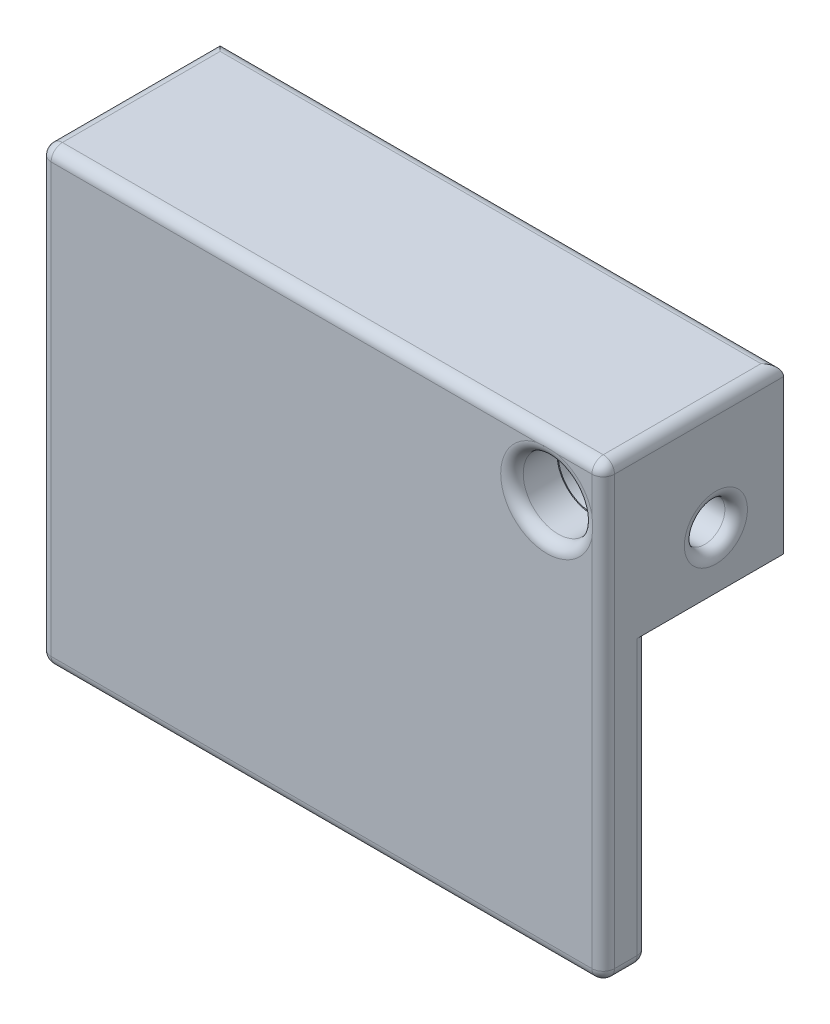
from build123d import *

# Parameters (mm, degrees)
ESQUISSE1_W             = 25
ESQUISSE1_H             = 20
ESQUISSE1_R             = 1.55
BOSS_EXTRU_1_DEPTH      = 2
ESQUISSE2_R             = 1.5
BOSS_EXTRU_2_DEPTH      = 6
ESQUISSE3_R             = 2
ENL_V_MAT_EXTRU_1_DEPTH = 1
ESQUISSE4_R             = 0.9
ENL_V_MAT_EXTRU_2_DEPTH = 33.57299495
CONG_1_R                = 0.5
CONG_5_R                = 0.5
CONG_6_R                = 0.5


with BuildPart() as part:
    # Esquisse1 → Boss.-Extru.1 (new body)
    with BuildSketch(Plane.XY):
        with Locations((12.5, 10)):
            Rectangle(ESQUISSE1_W, ESQUISSE1_H)
        with Locations((22.5, 17.5)):
            Circle(ESQUISSE1_R, mode=Mode.SUBTRACT)
    extrude(amount=BOSS_EXTRU_1_DEPTH)

    # Esquisse2 → Boss.-Extru.2 (add)
    with BuildSketch(Plane(origin=(0, 0, 0), x_dir=(-1, 0, 0), z_dir=(0, 0, -1))):
        Polygon((-18.688890735, 12.684019913), (-18.688890735, 15.355693182), (-18.19165929, 15.852924628), (-6.705637613, 15.852924628), (-4.442134245, 13.58942126), (-4.442134245, 13.288407081), (-1.8, 13.288407081), (-1.8, 2), (0, 2), (0, 13.565515823), (0, 20), (-25, 20), (-25, 12.684019913), align=None)
        with Locations((-22.5, 17.5)):
            Circle(ESQUISSE2_R, mode=Mode.SUBTRACT)
    extrude(amount=BOSS_EXTRU_2_DEPTH)

    # Esquisse3 → Enlèv. mat.-Extru.1 (cut)
    with BuildSketch(Plane(origin=(1.8, 0, 0), x_dir=(0, 0, -1), z_dir=(1, 0, 0))):
        with Locations(Location((3, 8, 0), (0, 0, 90))):
            Circle(ESQUISSE3_R)
    extrude(amount=-ENL_V_MAT_EXTRU_1_DEPTH, mode=Mode.SUBTRACT)

    # Esquisse4 → Enlèv. mat.-Extru.2 (cut, through all)
    with BuildSketch(Plane.ZY):
        with Locations((-3, 15.2)):
            Circle(ESQUISSE4_R)
    extrude(amount=-ENL_V_MAT_EXTRU_2_DEPTH, mode=Mode.SUBTRACT)

    # Congé1
    # the kernel refuses this fillet: 0.5 mm, written as the material it takes off along each edge
    with BuildSketch(Plane(origin=(25, 15.2, -3), x_dir=(0, 0, 1), z_dir=(0, -1, 0))) as cong_1_piece_1:
        with BuildLine():
            CenterArc((0.9 + CONG_1_R, CONG_1_R), CONG_1_R, 180, 90)
            Line((0.9, CONG_1_R), (0.9, 0))
            Line((0.9, 0), (0.9 + CONG_1_R, 0))
        make_face()
    revolve(axis=Axis((25, 15.2, -3), (-1, 0, 0)), mode=Mode.SUBTRACT)
    with BuildSketch(Plane(origin=(18.688890735, 15.2, -3), x_dir=(0, 0.9999845857082649, -0.005552327968503009), z_dir=(0, 0.005552327968503009, 0.9999845857082649))) as cong_1_piece_2_section:
        with BuildLine():
            CenterArc((0.9 + CONG_1_R, -CONG_1_R), CONG_1_R, 90, 90)
            Line((0.9 + CONG_1_R, 0), (0.9, 0))
            Line((0.9, 0), (0.9, -CONG_1_R))
        make_face()
    cong_1_piece_2 = revolve(axis=Axis((18.688890735, 15.2, -3), (-1, 0, 0)), revolution_arc=269.681873406, mode=Mode.PRIVATE)
    cong_1_piece_2 = split(cong_1_piece_2, bisect_by=Plane(origin=(19.358402527, 14.68618139, -3.05957258), z_dir=(-0.7071067811865438, -0.7071067811865513, 0)), keep=Keep.TOP, mode=Mode.PRIVATE)
    add(cong_1_piece_2, mode=Mode.SUBTRACT)
    with BuildSketch(Plane(origin=(0, 15.2, -3), x_dir=(0, 0, 1), z_dir=(0, -1, 0))) as cong_1_piece_3:
        with BuildLine():
            CenterArc((0.9 + CONG_1_R, -CONG_1_R), CONG_1_R, 90, 90)
            Line((0.9, -CONG_1_R), (0.9, 0))
            Line((0.9, 0), (0.9 + CONG_1_R, 0))
        make_face()
    revolve(axis=Axis((0, 15.2, -3), (-1, 0, 0)), mode=Mode.SUBTRACT)
    with BuildSketch(Plane(origin=(18.688890735, 15.2, -3), x_dir=(0, 0, 1), z_dir=(0, -1, 0))) as cong_1_piece_4_section:
        with BuildLine():
            CenterArc((0.9 + CONG_1_R, -CONG_1_R), CONG_1_R, 90, 90)
            Line((0.9 + CONG_1_R, 0), (0.9, 0))
            Line((0.9, 0), (0.9, -CONG_1_R))
        make_face()
    cong_1_piece_4 = revolve(axis=Axis((18.688890735, 15.2, -3), (-1, 0, 0)), revolution_arc=89.539713829, mode=Mode.PRIVATE)
    cong_1_piece_4 = split(cong_1_piece_4, bisect_by=Plane(origin=(18.759427014, 15.285156904, -1.94281096), z_dir=(-0.7071067811865438, -0.7071067811865513, 0)), keep=Keep.TOP, mode=Mode.PRIVATE)
    add(cong_1_piece_4, mode=Mode.SUBTRACT)

    # Congé5
    # the kernel refuses this fillet: 0.5 mm, written as the material it takes off along each edge
    with BuildSketch(Plane(origin=(24.5, 0.5, 1.5), x_dir=(0, 0, 1), z_dir=(0, -1, 0))) as cong_5_piece_1_section:
        Polygon((0, 0), (CONG_5_R, 0), (CONG_5_R, -CONG_5_R), (0, -CONG_5_R), align=None)
    cong_5_piece_1 = extrude(amount=CONG_5_R, mode=Mode.PRIVATE)
    cong_5_piece_1 = cong_5_piece_1 - Plane(origin=(24.5, 0.5, 1.5), x_dir=(-0.7071067811865475, 0, -0.7071067811865475), z_dir=(0, -1, 0)) * Sphere(CONG_5_R, mode=Mode.PRIVATE)
    add(cong_5_piece_1, mode=Mode.SUBTRACT)
    with BuildSketch(Plane(origin=(24.5, 19.5, 1.5), x_dir=(1, 0, 0), z_dir=(0, 0, 1))) as cong_5_piece_2_section:
        Polygon((0, 0), (CONG_5_R, 0), (CONG_5_R, CONG_5_R), (0, CONG_5_R), align=None)
    cong_5_piece_2 = extrude(amount=CONG_5_R, mode=Mode.PRIVATE)
    cong_5_piece_2 = cong_5_piece_2 - Plane(origin=(24.5, 19.5, 1.5), x_dir=(-0.7071067811865475, -0.7071067811865475, 0), z_dir=(0, 0, 1)) * Sphere(CONG_5_R, mode=Mode.PRIVATE)
    add(cong_5_piece_2, mode=Mode.SUBTRACT)
    with BuildSketch(Plane(origin=(0.5, 19.5, 1.5), x_dir=(-1, 0, 0), z_dir=(0, 0, 1))) as cong_5_piece_3_section:
        Polygon((0, 0), (CONG_5_R, 0), (CONG_5_R, -CONG_5_R), (0, -CONG_5_R), align=None)
    cong_5_piece_3 = extrude(amount=CONG_5_R, mode=Mode.PRIVATE)
    cong_5_piece_3 = cong_5_piece_3 - Plane(origin=(0.5, 19.5, 1.5), x_dir=(0.7071067811865475, -0.7071067811865475, 0), z_dir=(0, 0, 1)) * Sphere(CONG_5_R, mode=Mode.PRIVATE)
    add(cong_5_piece_3, mode=Mode.SUBTRACT)
    with BuildSketch(Plane(origin=(0.5, 0.5, 1.5), x_dir=(0, 0, 1), z_dir=(0, -1, 0))) as cong_5_piece_4_section:
        Polygon((0, 0), (CONG_5_R, 0), (CONG_5_R, CONG_5_R), (0, CONG_5_R), align=None)
    cong_5_piece_4 = extrude(amount=CONG_5_R, mode=Mode.PRIVATE)
    cong_5_piece_4 = cong_5_piece_4 - Plane(origin=(0.5, 0.5, 1.5), x_dir=(0.7071067811865475, 0, -0.7071067811865475), z_dir=(0, -1, 0)) * Sphere(CONG_5_R, mode=Mode.PRIVATE)
    add(cong_5_piece_4, mode=Mode.SUBTRACT)
    with BuildSketch(Plane(origin=(22.5, 17.5, 2), x_dir=(1, 0, 0), z_dir=(0, -1, 0))) as cong_5_piece_5:
        with BuildLine():
            CenterArc((1.55 + CONG_5_R, -CONG_5_R), CONG_5_R, 90, 90)
            Line((1.55, -CONG_5_R), (1.55, 0))
            Line((1.55, 0), (1.55 + CONG_5_R, 0))
        make_face()
    revolve(axis=Axis((22.5, 17.5, 2), (0, 0, 1)), mode=Mode.SUBTRACT)
    with BuildSketch(Plane(origin=(25, 0.5, 2), x_dir=(-1, 0, 0), z_dir=(0, 1, 0)), Plane(origin=(0, 19.5, 2), x_dir=(1, 0, 0), z_dir=(0, -1, 0))) as cong_5_piece_6:
        with BuildLine():
            CenterArc((CONG_5_R, -CONG_5_R), CONG_5_R, 90, 90)
            Line((0, -CONG_5_R), (0, 0))
            Line((0, 0), (CONG_5_R, 0))
        make_face()
    extrude(amount=19, mode=Mode.SUBTRACT)
    with BuildSketch(Plane(origin=(24.5, 20, 2), x_dir=(0, -1, 0), z_dir=(-1, 0, 0))) as cong_5_piece_7:
        with BuildLine():
            CenterArc((CONG_5_R, -CONG_5_R), CONG_5_R, 90, 90)
            Line((0, -CONG_5_R), (0, 0))
            Line((0, 0), (CONG_5_R, 0))
        make_face()
    extrude(amount=24, mode=Mode.SUBTRACT)
    with BuildSketch(Plane(origin=(-1.25, 20, -6), x_dir=(0, -1, 0), z_dir=(1, 0, 0)), Plane(origin=(-1.25, 0, 0), x_dir=(0, 0, 1), z_dir=(1, 0, 0))) as cong_5_piece_8:
        with BuildLine():
            CenterArc((CONG_5_R, -CONG_5_R), CONG_5_R, 90, 90)
            Line((0, -CONG_5_R), (0, 0))
            Line((0, 0), (CONG_5_R, 0))
        make_face()
    extrude(amount=27.5, mode=Mode.SUBTRACT)
    with BuildSketch(Plane(origin=(0, 20, 1.5), x_dir=(1, 0, 0), z_dir=(0, 0, -1)), Plane(origin=(25, 20, -7.25), x_dir=(-1, 0, 0), z_dir=(0, 0, 1))) as cong_5_piece_9:
        with BuildLine():
            CenterArc((CONG_5_R, CONG_5_R), CONG_5_R, 180, 90)
            Line((0, CONG_5_R), (0, 0))
            Line((0, 0), (CONG_5_R, 0))
        make_face()
    extrude(amount=8.75, mode=Mode.SUBTRACT)
    with BuildSketch(Plane(origin=(25, 0, -1.25), x_dir=(-1, 0, 0), z_dir=(0, 0, 1))) as cong_5_piece_10:
        with BuildLine():
            CenterArc((CONG_5_R, -CONG_5_R), CONG_5_R, 90, 90)
            Line((0, -CONG_5_R), (0, 0))
            Line((0, 0), (CONG_5_R, 0))
        make_face()
    extrude(amount=2.75, mode=Mode.SUBTRACT)
    with BuildSketch(Plane(origin=(0, 0, -1.25), x_dir=(1, 0, 0), z_dir=(0, 0, 1))) as cong_5_piece_11:
        with BuildLine():
            CenterArc((CONG_5_R, CONG_5_R), CONG_5_R, 180, 90)
            Line((0, CONG_5_R), (0, 0))
            Line((0, 0), (CONG_5_R, 0))
        make_face()
    extrude(amount=2.75, mode=Mode.SUBTRACT)
    with BuildSketch(Plane(origin=(0.5, 0, 2), x_dir=(0, 0, -1), z_dir=(1, 0, 0))) as cong_5_piece_12:
        with BuildLine():
            CenterArc((CONG_5_R, CONG_5_R), CONG_5_R, 180, 90)
            Line((0, CONG_5_R), (0, 0))
            Line((0, 0), (CONG_5_R, 0))
        make_face()
    extrude(amount=24, mode=Mode.SUBTRACT)

    # Congé6
    # the kernel refuses this fillet: 0.5 mm, written as the material it takes off along each edge
    with BuildSketch(Plane(origin=(24.5, 0.5, 0.5), x_dir=(1, 0, 0), z_dir=(0, 0, -1))) as cong_6_piece_1_section:
        Polygon((0, 0), (CONG_6_R, 0), (CONG_6_R, CONG_6_R), (0, CONG_6_R), align=None)
    cong_6_piece_1 = extrude(amount=CONG_6_R, mode=Mode.PRIVATE)
    cong_6_piece_1 = cong_6_piece_1 - Plane(origin=(24.5, 0.5, 0.5), x_dir=(-0.7071067811865475, 0.7071067811865475, 0), z_dir=(0, 0, -1)) * Sphere(CONG_6_R, mode=Mode.PRIVATE)
    add(cong_6_piece_1, mode=Mode.SUBTRACT)
    with BuildSketch(Plane(origin=(25, 0.5, 0), x_dir=(-1, 0, 0), z_dir=(0, 1, 0))) as cong_6_piece_2:
        with BuildLine():
            CenterArc((CONG_6_R, CONG_6_R), CONG_6_R, 180, 90)
            Line((0, CONG_6_R), (0, 0))
            Line((0, 0), (CONG_6_R, 0))
        make_face()
    extrude(amount=12.184019913, mode=Mode.SUBTRACT)


solid = part.part
